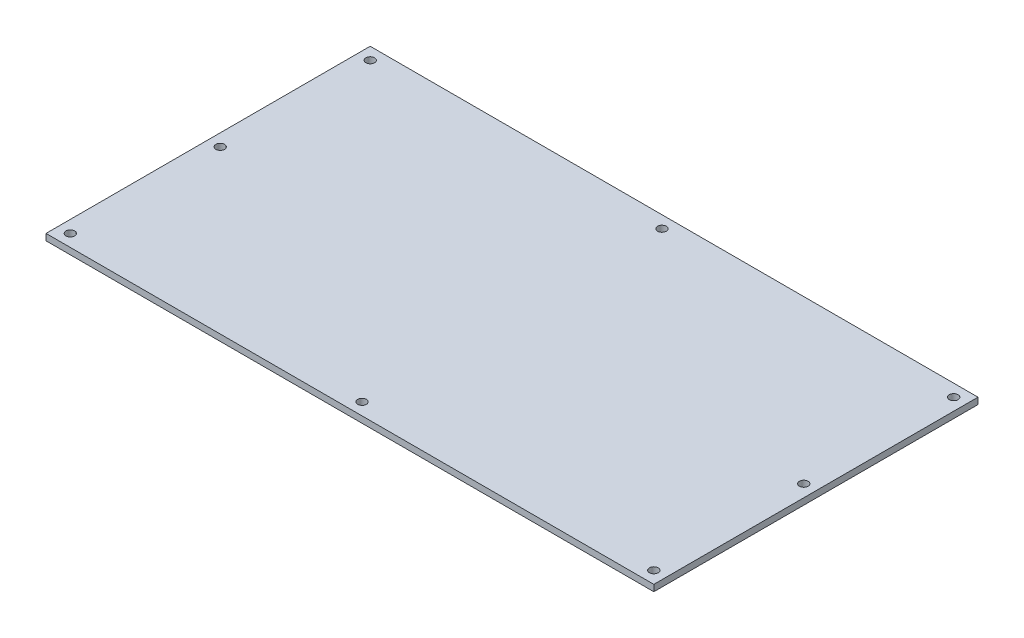
from build123d import *

# Parameters (mm, degrees)
SKETCH1_W           = 300
SKETCH1_H           = 160
SKETCH1_R           = 2.15
BOSS_EXTRUDE1_DEPTH = 3.175


with BuildPart() as part:
    # Sketch1 → Boss-Extrude1 (new body)
    with BuildSketch(Plane(origin=(0, 0, 0), x_dir=(1, 0, 0), z_dir=(0, 1, 0))):
        with Locations((150, 80)):
            Rectangle(SKETCH1_W, SKETCH1_H)
        with Locations((294, 6)):
            Circle(SKETCH1_R, mode=Mode.SUBTRACT)
        with Locations((6, 6)):
            Circle(SKETCH1_R, mode=Mode.SUBTRACT)
        with Locations((294, 154)):
            Circle(SKETCH1_R, mode=Mode.SUBTRACT)
        with Locations((6, 154)):
            Circle(SKETCH1_R, mode=Mode.SUBTRACT)
        with Locations((294, 80)):
            Circle(SKETCH1_R, mode=Mode.SUBTRACT)
        with Locations((150, 6)):
            Circle(SKETCH1_R, mode=Mode.SUBTRACT)
        with Locations((150, 154)):
            Circle(SKETCH1_R, mode=Mode.SUBTRACT)
        with Locations((6, 80)):
            Circle(SKETCH1_R, mode=Mode.SUBTRACT)
    extrude(amount=BOSS_EXTRUDE1_DEPTH)


solid = part.part
